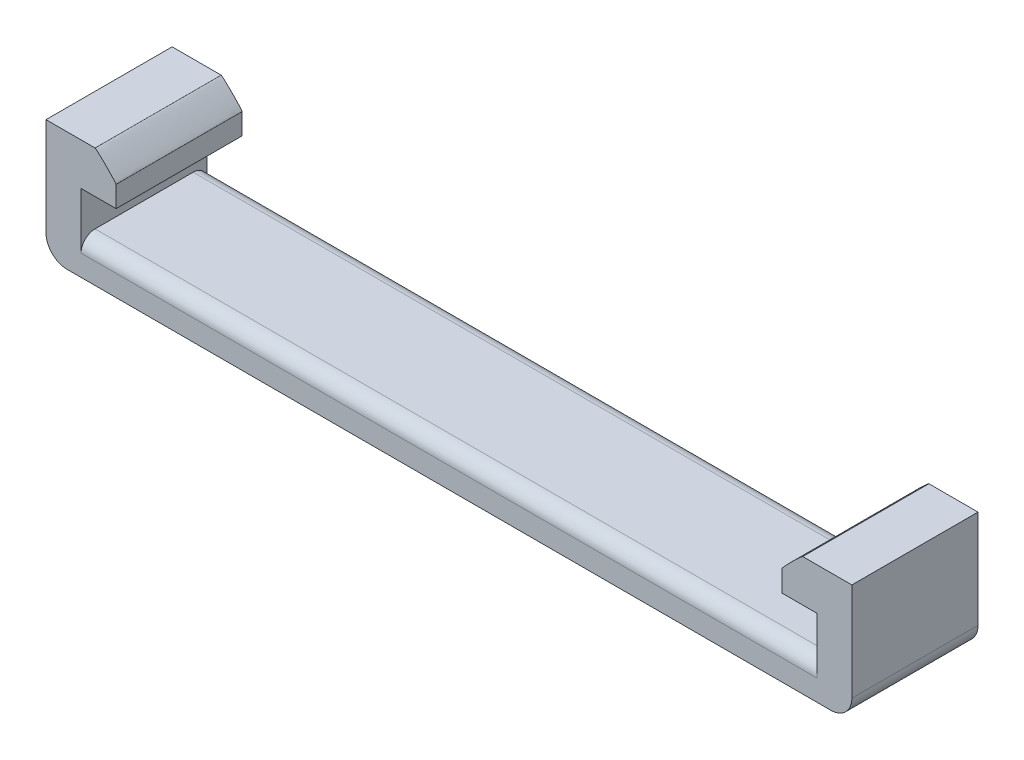
from build123d import *

# Parameters (mm, degrees)
SKETCH1_W           = 23
SKETCH1_H           = 3.6
BOSS_EXTRUDE1_DEPTH = 1
SKETCH2_W           = 1
SKETCH2_H           = 3.6
BOSS_EXTRUDE2_DEPTH = 2.4
SKETCH3_W           = 1
SKETCH3_H           = 1.2
BOSS_EXTRUDE3_DEPTH = 3.6
FILLET1_SIZE        = 0.6
FILLET2_R           = 0.6
FILLET3_R           = 0.4


with BuildPart() as part:
    # Sketch1 → Boss-Extrude1 (new body)
    with BuildSketch(Plane(origin=(0, 0, 0), x_dir=(1, 0, 0), z_dir=(0, 1, 0))):
        with Locations((11.5, -1.8)):
            Rectangle(SKETCH1_W, SKETCH1_H)
    extrude(amount=BOSS_EXTRUDE1_DEPTH)

    # Sketch2 → Boss-Extrude2 (add)
    with BuildSketch(Plane(origin=(0, 1, 0), x_dir=(1, 0, 0), z_dir=(0, 1, 0))):
        with Locations((0.5, -1.8)):
            Rectangle(SKETCH2_W, SKETCH2_H)
        with Locations((22.5, -1.8)):
            Rectangle(SKETCH2_W, SKETCH2_H)
    extrude(amount=BOSS_EXTRUDE2_DEPTH)

    # Sketch3 → Boss-Extrude3 (add)
    with BuildSketch(Plane.XY.offset(3.6)):
        with Locations((1.5, 2.8)):
            Rectangle(SKETCH3_W, SKETCH3_H)
        with Locations((21.5, 2.8)):
            Rectangle(SKETCH3_W, SKETCH3_H)
    extrude(amount=-BOSS_EXTRUDE3_DEPTH)

    # Fillet1
    # a fillet whose section is not a circle: 0.6 mm, written as the material it takes off along each edge
    with BuildSketch(Plane(origin=(21, 3.4, 5.1), x_dir=(1, 0, 0), z_dir=(0, 0, -1)), Plane(origin=(2, 3.4, 5.1), x_dir=(0, -1, 0), z_dir=(0, 0, -1))) as fillet1_piece_1:
        with BuildLine():
            Bezier((FILLET1_SIZE, 0), (0, 0), (0, FILLET1_SIZE), weights=[1, 0.052631579, 1])
            Line((0, FILLET1_SIZE), (0, 0))
            Line((0, 0), (FILLET1_SIZE, 0))
        make_face()
    extrude(amount=6.6, mode=Mode.SUBTRACT)

    # Fillet2
    fillet2_edges = [part.edges().sort_by_distance(p)[0] for p in [
        (23, 0, 1.8),
        (0, 0, 1.8),
    ]]
    fillet(fillet2_edges, radius=FILLET2_R)

    # Fillet3
    fillet3_edges = [part.edges().sort_by_distance(p)[0] for p in [
        (11.5, 1, 3.6),
        (11.5, 1, 0),
    ]]
    fillet(fillet3_edges, radius=FILLET3_R)


solid = part.part
